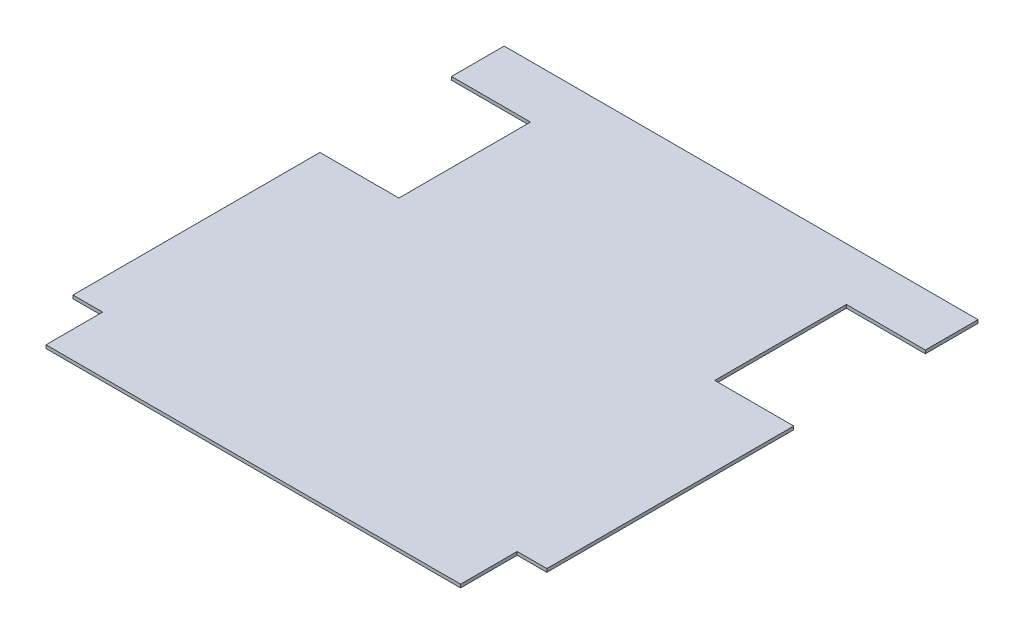
from build123d import *

# Parameters (mm, degrees)
BOSS_EXTRUDE1_DEPTH = 3.175


with BuildPart() as part:
    # Sketch1 → Boss-Extrude1 (new body)
    with BuildSketch(Plane(origin=(0, 0, 0), x_dir=(1, 0, 0), z_dir=(0, 1, 0))):
        Polygon((381, 238.252), (457.2, 238.252), (457.2, 0), (428.625, 0), (428.625, -54.61), (28.575, -54.61), (28.575, 0), (0, 0), (0, 238.252), (76.2, 238.252), (76.2, 365.252), (0, 365.252), (0, 416.052), (457.2, 416.052), (457.2, 365.252), (381, 365.252), align=None)
    extrude(amount=BOSS_EXTRUDE1_DEPTH)


solid = part.part
